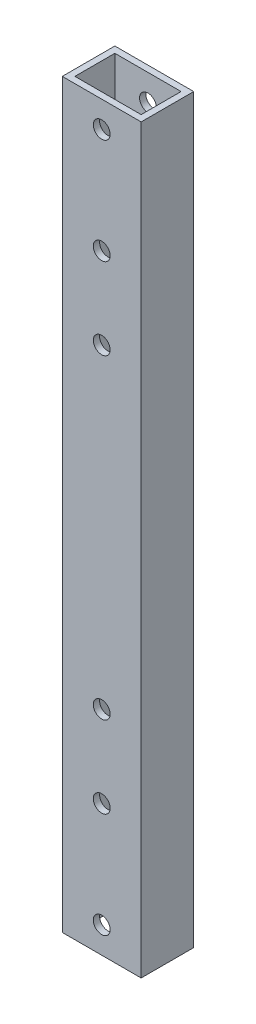
from build123d import *

# Parameters (mm, degrees)
SKETCH_1_W          = 15
SKETCH_1_H          = 10
SKETCH_1_W_2        = 12.6
SKETCH_1_H_2        = 7.6
EXTRUDE_1_DEPTH     = 70.5
SKETCH_2_R          = 1.6
CUT_EXTRUDE_1_DEPTH = 100


with BuildPart() as part:
    # ｽｹｯﾁ1 → ﾎﾞｽ - 押し出し1 (new, symmetric)
    with BuildSketch(Plane(origin=(0, 0, 0), x_dir=(1, 0, 0), z_dir=(0, 1, 0))):
        Rectangle(SKETCH_1_W, SKETCH_1_H)
        Rectangle(SKETCH_1_W_2, SKETCH_1_H_2, mode=Mode.SUBTRACT)
    extrude(amount=EXTRUDE_1_DEPTH, both=True)

    # ｽｹｯﾁ2 → ｶｯﾄ - 押し出し1 (cut)
    with BuildSketch(Plane(origin=(0, 0, -5), x_dir=(-1, 0, 0), z_dir=(0, 0, -1))):
        with Locations((0, -65.5)):
            Circle(SKETCH_2_R)
        with Locations((0, -45.5)):
            Circle(SKETCH_2_R)
        with Locations((0, 45.5)):
            Circle(SKETCH_2_R)
        with Locations((0, 65.5)):
            Circle(SKETCH_2_R)
        with Locations((0, -30)):
            Circle(SKETCH_2_R)
        with Locations((0, 30)):
            Circle(SKETCH_2_R)
    extrude(amount=-CUT_EXTRUDE_1_DEPTH, mode=Mode.SUBTRACT)


solid = part.part
